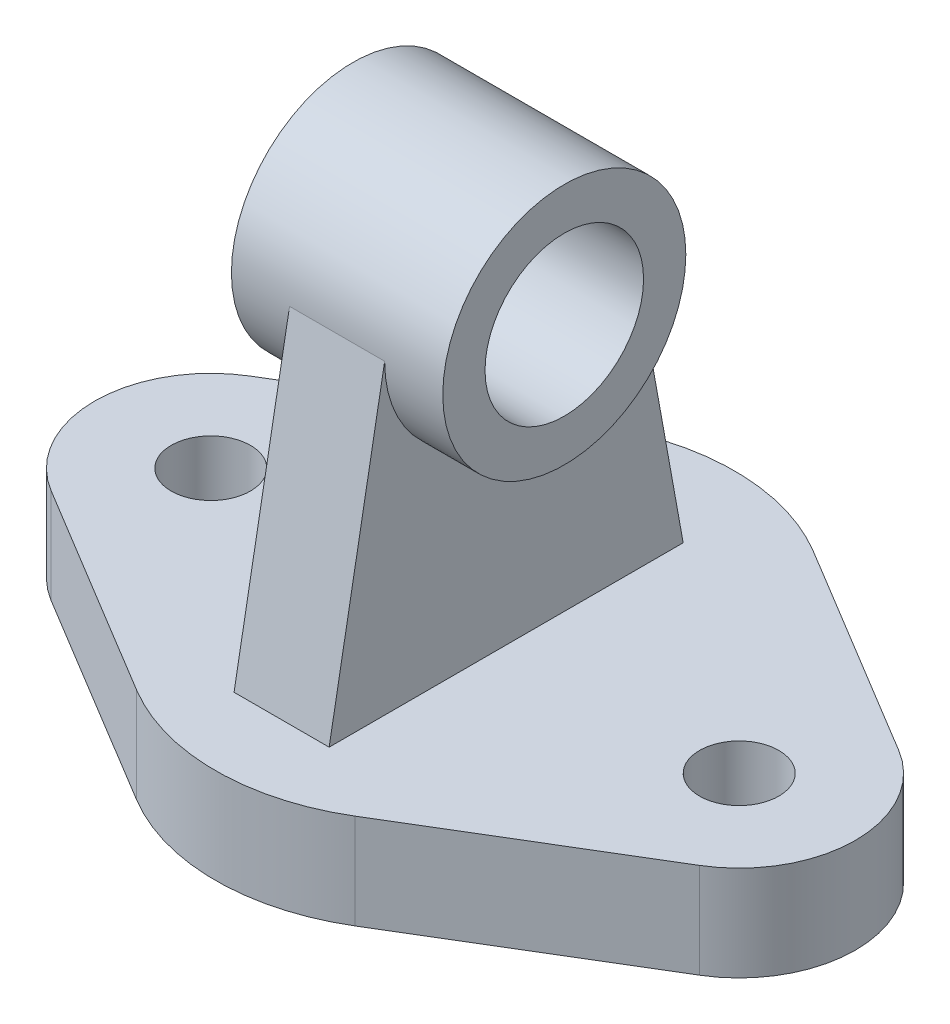
from build123d import *
from build123d.topology import SkipClean

# Parameters (mm, degrees)
SKETCH2_R           = 7.5
BOSS_EXTRUDE1_DEPTH = 18
SKETCH6_R           = 15
BOSS_EXTRUDE2_DEPTH = 18
SKETCH7_R           = 23
SKETCH7_R_2         = 15
BOSS_EXTRUDE3_DEPTH = 11
BOSS_EXTRUDE4_START = 11
SKETCH8_R           = 23
SKETCH8_R_2         = 15
BOSS_EXTRUDE4_DEPTH = 11


with BuildPart() as part:
    # Sketch2 → Boss-Extrude1 (new body)
    with BuildSketch(Plane(origin=(0, 0, 0), x_dir=(1, 0, 0), z_dir=(0, 1, 0))):
        with BuildLine():
            Line((-50.28472319, 19.35816392), (-9.579447433, 43.902799527))
            ThreePointArc((-9.579447433, 43.902799527), (11.075495329, 49.648262025), (31.730438092, 43.902799527))
            Line((31.730438092, 43.902799527), (72.435713849, 19.35816392))
            ThreePointArc((72.435713849, 19.35816392), (83.075495329, 0.518168294), (72.435713849, -18.321827333))
            Line((72.435713849, -18.321827333), (31.730438092, -42.86646294))
            ThreePointArc((31.730438092, -42.86646294), (11.075495329, -48.611925438), (-9.579447433, -42.86646294))
            Line((-9.579447433, -42.86646294), (-50.28472319, -18.321827333))
            ThreePointArc((-50.28472319, -18.321827333), (-60.924504671, 0.518168294), (-50.28472319, 19.35816392))
        make_face()
        with Locations((-38.924504671, 0.518168294)):
            Circle(SKETCH2_R, mode=Mode.SUBTRACT)
        with Locations((61.075495329, 0.518168294)):
            Circle(SKETCH2_R, mode=Mode.SUBTRACT)
    extrude(amount=BOSS_EXTRUDE1_DEPTH)

    # Sketch6 → Boss-Extrude2 (add)
    with BuildSketch(Plane(origin=(0, 0, 0), x_dir=(0, 0, -1), z_dir=(1, 0, 0))):
        with BuildLine():
            Line((-34.007106684, 18), (-23.507106684, 76))
            ThreePointArc((-23.507106684, 76), (-0.507106684, 99), (22.492893316, 76))
            Line((22.492893316, 76), (32.992893316, 18))
            Line((32.992893316, 18), (-34.007106684, 18))
        make_face()
        with Locations((-0.507106684, 76)):
            Circle(SKETCH6_R, mode=Mode.SUBTRACT)
    extrude(amount=BOSS_EXTRUDE2_DEPTH)

    # Sketch7 → Boss-Extrude3 (add)
    with SkipClean():  # the faces are left unmerged after this step: merging them gives an invalid solid
        with BuildSketch(Plane(origin=(18, 0, 0), x_dir=(0, 0, -1), z_dir=(1, 0, 0))):
            with Locations((-0.507106684, 76)):
                Circle(SKETCH7_R)
            with Locations((-0.507106684, 76)):
                Circle(SKETCH7_R_2, mode=Mode.SUBTRACT)
        extrude(amount=BOSS_EXTRUDE3_DEPTH)
    add(part.part.scale(1), mode=Mode.REPLACE)  # the faces are merged on a copy

    # Sketch8 → Boss-Extrude4 (add)
    with SkipClean():  # the faces are left unmerged after this step: merging them gives an invalid solid
        with BuildSketch(Plane.ZY.offset(BOSS_EXTRUDE4_START)):
            with Locations((0.507106684, 76)):
                Circle(SKETCH8_R)
            with Locations((0.507106684, 76)):
                Circle(SKETCH8_R_2, mode=Mode.SUBTRACT)
        extrude(amount=-BOSS_EXTRUDE4_DEPTH)
    add(part.part.scale(1), mode=Mode.REPLACE)  # the faces are merged on a copy


solid = part.part
